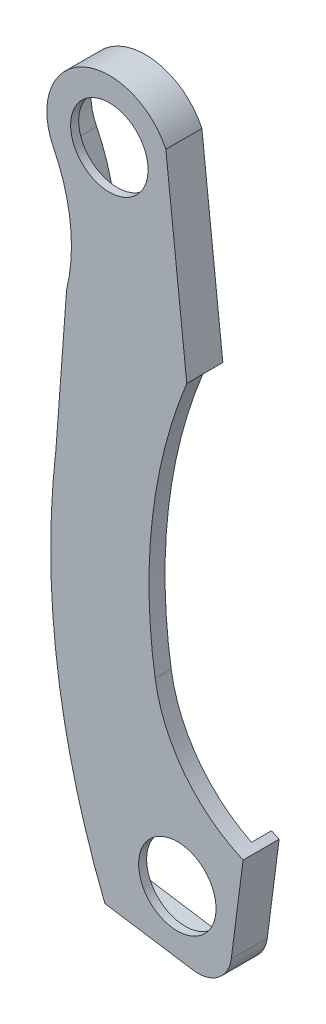
from build123d import *

# Parameters (mm, degrees)
BOSS_EXTRUDE1_DEPTH     = 3.429
FILLET1_R               = 3.175
SKETCH2_R               = 2.921
CUT_EXTRUDE1_DEPTH      = 110.435380853
SHELL2_OUTLINE_R        = 3.683
SHELL2_DEPTH            = 2.667
CUT_EXTRUDE2_REACH      = 111.435
SKETCH3_R               = 3.683
CUT_EXTRUDE3_REACH      = 80.749
SKETCH4_W               = 1.905
SKETCH4_H               = 36.940823868
CUT_EXTRUDE4_DEPTH      = 110.435380853
CUT_EXTRUDE4_DEPTH_BACK = 1.778
CUT_EXTRUDE5_DEPTH      = 0.127


# Read off the part's stored shape, not the designer's step: Shell2
with BuildPart() as part:
    # Sketch1 → Boss-Extrude1 (new body)
    with BuildSketch(Plane.XY):
        with BuildLine():
            Line((62.7345016, 80.577747087), (64.726975666, 62.289747087))
            ThreePointArc((64.726975666, 62.289747087), (61.454694837, 49.585208184), (61.721936912, 36.468740968))
            ThreePointArc((61.721936912, 36.468740968), (64.516939118, 30.014666788), (70.081936923, 25.713747087))
            Line((70.081936923, 25.713747087), (68.536975666, 13.775747087))
            Line((68.536975666, 13.775747087), (56.940284848, 15.553747087))
            ThreePointArc((56.940284848, 15.553747087), (52.413143628, 32.787644792), (52.280975666, 50.605747087))
            Line((52.280975666, 50.605747087), (53.296975666, 64.302418224))
            ThreePointArc((53.296975666, 64.302418224), (53.653310061, 69.952097941), (52.044858214, 75.37968836))
            ThreePointArc((52.044858214, 75.37968836), (54.7617878, 83.382894736), (62.7345016, 80.577747087))
        make_face()
    extrude(amount=BOSS_EXTRUDE1_DEPTH)

    # Fillet1
    fillet1_edges = [part.edges().sort_by_distance(p)[0] for p in [
        (68.536975666, 13.775747087, 1.7145),
    ]]
    fillet(fillet1_edges, radius=FILLET1_R)

    # Sketch2 → Cut-Extrude1 (cut, through all)
    with BuildSketch(Plane.XY.offset(3.429)):
        with Locations((57.360975666, 78.037747087)):
            Circle(SKETCH2_R)
        with Locations((63.826413409, 20.421081821)):
            Circle(SKETCH2_R)
    extrude(amount=-CUT_EXTRUDE1_DEPTH, mode=Mode.SUBTRACT)

    # Shell2 outline → Shell2 (cut)
    with BuildSketch(Plane.XY):
        with BuildLine():
            ThreePointArc((61.991345759, 80.363397827), (55.039508366, 82.670215989), (52.726411733, 75.72046512))
            ThreePointArc((52.726411733, 75.72046512), (54.406890906, 70.069245661), (54.052294982, 64.184132803))
            Line((54.052294982, 64.184132803), (53.039664753, 50.532889471))
            ThreePointArc((53.039664753, 50.532889471), (53.139176681, 33.111364087), (57.487066991, 16.240818773))
            Line((57.487066991, 16.240818773), (65.439706148, 15.021523317))
            ThreePointArc((65.439706148, 15.021523317), (67.256047768, 15.478396864), (68.198436672, 17.096955938))
            Line((68.198436672, 17.096955938), (69.253887741, 25.252483979))
            ThreePointArc((69.253887741, 25.252483979), (63.739946861, 29.77722029), (60.969261533, 36.349897487))
            ThreePointArc((60.969261533, 36.349897487), (60.686685648, 49.576935849), (63.948610548, 62.398567528))
            Line((63.948610548, 62.398567528), (61.991345759, 80.363397827))
        make_face()
        with Locations((63.826413409, 20.421081821)):
            Circle(SHELL2_OUTLINE_R, mode=Mode.SUBTRACT)
        with Locations((57.360975666, 78.037747087)):
            Circle(SHELL2_OUTLINE_R, mode=Mode.SUBTRACT)
    extrude(amount=SHELL2_DEPTH, mode=Mode.SUBTRACT)

    # Sketch3 → Cut-Extrude2 (cut, up to next)
    with BuildSketch(Plane(origin=(0, 0, 0), x_dir=(-1, 0, 0), z_dir=(0, 0, -1)), mode=Mode.PRIVATE) as cut_extrude2_sk1:
        with Locations((-57.360975666, 78.037747087)):
            Circle(SKETCH3_R)
    cut_extrude2_tool1 = extrude(cut_extrude2_sk1.sketch, amount=-CUT_EXTRUDE2_REACH, mode=Mode.PRIVATE) & part.part
    # Sketch3 → Cut-Extrude2 (cut, up to next)
    with BuildSketch(Plane(origin=(0, 0, 0), x_dir=(-1, 0, 0), z_dir=(0, 0, -1)), mode=Mode.PRIVATE) as cut_extrude2_sk2:
        with Locations((-63.826413409, 20.421081821)):
            Circle(SKETCH3_R)
    cut_extrude2_tool2 = extrude(cut_extrude2_sk2.sketch, amount=-CUT_EXTRUDE2_REACH, mode=Mode.PRIVATE) & part.part
    add(cut_extrude2_tool1.solids().sort_by_distance((57.360976, 78.037747, 0))[0], mode=Mode.SUBTRACT)
    add(cut_extrude2_tool2.solids().sort_by_distance((63.826413, 20.421082, 0))[0], mode=Mode.SUBTRACT)

    # Sketch4 → Cut-Extrude3 (cut, up to next)
    with BuildSketch(Plane(origin=(70.674520745, 7.699975379, 0), x_dir=(0, 0, -1), z_dir=(0.9941172894005426, 0.10830888659255154, 0)), mode=Mode.PRIVATE) as cut_extrude3_sk1:
        with Locations((-0.9525, 36.44239593)):
            Rectangle(SKETCH4_W, SKETCH4_H)
    cut_extrude3_tool1 = extrude(cut_extrude3_sk1.sketch, amount=-CUT_EXTRUDE3_REACH, mode=Mode.PRIVATE) & part.part
    add(cut_extrude3_tool1.solids().sort_by_distance((66.727485, 43.927991, 0.9525))[0], mode=Mode.SUBTRACT)

    # Sketch5 → Cut-Extrude4 (cut, two sides: drawn at the far end of the back side and taken through both)
    with BuildSketch(Plane(origin=(0, 0, 0), x_dir=(-1, 0, 0), z_dir=(0, 0, -1)).offset(-CUT_EXTRUDE4_DEPTH_BACK)):
        with BuildLine():
            Line((-69.357085228, 26.049896593), (-69.253887741, 25.252483979))
            ThreePointArc((-69.253887741, 25.252483979), (-68.949955482, 25.401641313), (-68.649499804, 25.557683339))
            Line((-68.649499804, 25.557683339), (-68.727995169, 25.566235394))
            Line((-68.727995169, 25.566235394), (-68.633052886, 26.437666796))
            ThreePointArc((-68.633052886, 26.437666796), (-68.992244892, 26.238508503), (-69.357085228, 26.049896593))
        make_face()
    extrude(amount=CUT_EXTRUDE4_DEPTH + CUT_EXTRUDE4_DEPTH_BACK, mode=Mode.SUBTRACT)

    # Sketch6 → Cut-Extrude5 (cut)
    with BuildSketch(Plane(origin=(0, 0, 1.778), x_dir=(-1, 0, 0), z_dir=(0, 0, -1))):
        with BuildLine():
            Line((-69.357085228, 26.049896593), (-69.253887741, 25.252483979))
            ThreePointArc((-69.253887741, 25.252483979), (-68.949955482, 25.401641313), (-68.649499804, 25.557683339))
            Line((-68.649499804, 25.557683339), (-68.727995169, 25.566235394))
            Line((-68.727995169, 25.566235394), (-68.633052886, 26.437666796))
            ThreePointArc((-68.633052886, 26.437666796), (-68.992244892, 26.238508503), (-69.357085228, 26.049896593))
        make_face()
    extrude(amount=-CUT_EXTRUDE5_DEPTH, mode=Mode.SUBTRACT)


solid = part.part
